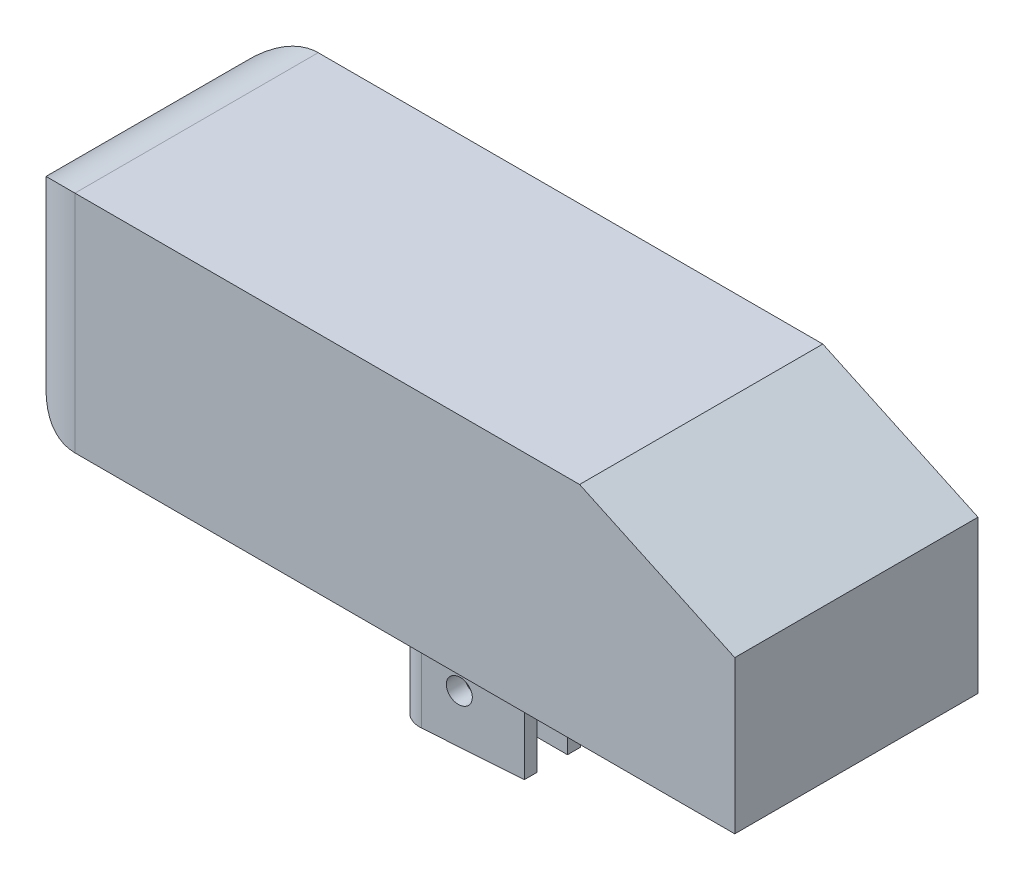
from build123d import *

# Parameters (mm, degrees)
SKETCH1_W            = 1044
SKETCH1_H            = 348
BOSS_EXTRUDE1_DEPTH  = 321.9
CHAMFER2_SIZE        = 222
CHAMFER2_SIZE2       = 103.52030011
FILLET1_R            = 100
SCALE1_SCALE         = 0.115
SKETCH175_W          = 20
SKETCH175_H          = 12
BOSS_EXTRUDE12_DEPTH = 25
SKETCH176_W          = 5
SKETCH176_H          = 25
CUT_EXTRUDE1_DEPTH   = 30
SKETCH177_R          = 2
CUT_EXTRUDE2_DEPTH   = 30
CUT_EXTRUDE4_DEPTH   = 25
FILLET3_R            = 4


with BuildPart() as part:
    # Sketch1 → Boss-Extrude1 (new body)
    with BuildSketch(Plane(origin=(0, 0, 0), x_dir=(1, 0, 0), z_dir=(0, 1, 0))):
        Rectangle(SKETCH1_W, SKETCH1_H)
    extrude(amount=BOSS_EXTRUDE1_DEPTH)

    # Chamfer2
    chamfer2_edges = [part.edges().sort_by_distance(p)[0] for p in [
        (522, 321.9, 0),
    ]]
    chamfer2_side = [part.faces().sort_by_distance(p)[0] for p in [
        (0, 321.9, 0),
    ]]
    chamfer(chamfer2_edges, length=CHAMFER2_SIZE, length2=CHAMFER2_SIZE2, reference=chamfer2_side[0])

    # Fillet1
    fillet1_edges = [part.edges().sort_by_distance(p)[0] for p in [
        (-522, 321.9, 0),
        (-522, 0, 0),
        (-522, 160.95, -174),
        (-522, 160.95, 174),
    ]]
    fillet(fillet1_edges, radius=FILLET1_R)


with BuildPart() as part_1:
    # Scale1: scaled about (-4.978902211, 156.372589253, 0)
    add(part.part.scale(SCALE1_SCALE).moved(Location((-4.406328457, 138.389741489, 0))))


with BuildPart() as boss_extrude12_tool:
    # Sketch175 → Boss-Extrude12 (new body)
    with BuildSketch(Plane.XZ.offset(-138.389734505)):
        with Locations((-4.405349795, 0)):
            Rectangle(SKETCH175_W, SKETCH175_H)
    extrude(amount=BOSS_EXTRUDE12_DEPTH)


with BuildPart() as part_2:
    add(part_1.part)


with BuildPart() as part_3:
    # Boss-Extrude12: joined with boss_extrude12_tool
    add(part_2.part.fuse(boss_extrude12_tool.part, tol=0.00001))

    # Sketch176 → Cut-Extrude1 (cut)
    with BuildSketch(Plane(origin=(5.594650205, 0, 0), x_dir=(0, 0, -1), z_dir=(1, 0, 0))):
        with Locations((0, 125.889734505)):
            Rectangle(SKETCH176_W, SKETCH176_H)
    extrude(amount=-CUT_EXTRUDE1_DEPTH, mode=Mode.SUBTRACT)

    # Sketch177 → Cut-Extrude2 (cut)
    with BuildSketch(Plane(origin=(0, 0, -6), x_dir=(-1, 0, 0), z_dir=(0, 0, -1))):
        with Locations((4.405349795, 121.389734505)):
            Circle(SKETCH177_R)
    extrude(amount=-CUT_EXTRUDE2_DEPTH, mode=Mode.SUBTRACT)

    # Sketch179 → Cut-Extrude4 (cut)
    with BuildSketch(Plane.XZ.offset(-113.389734505)):
        Polygon((-14.405349795, 6), (20.594650205, 3.552561582), (20.594650205, -3.552561582), (-14.405349795, -6), (23.594650205, -6), (23.594650205, 6), align=None)
    extrude(amount=-CUT_EXTRUDE4_DEPTH, mode=Mode.SUBTRACT)

    # Fillet3
    # the kernel refuses this fillet: 4 mm, written as the material it takes off along each edge
    with BuildSketch(Plane(origin=(-14.405349795, 138.389734505, -6), x_dir=(0, 0, 1), z_dir=(0, -1, 0))) as fillet3_piece_1:
        with BuildLine():
            CenterArc((4.284048925, -3.922405803), FILLET3_R, 101.30386139, 82.69613861)
            Line((0.293792724, -4.201431698), (0.2139876, -4.207012216))
            Line((0.2139876, -4.207012216), (-0.079805124, -0.005580518))
            Line((-0.079805124, -0.005580518), (0, 0.08))
            ThreePointArc((0, 0.08), (1.75, 0.08), (3.484319021, 0.078448116))
            Line((3.484319021, 0.078448116), (3.5, 0))
        make_face()
    extrude(amount=35.529227915, mode=Mode.SUBTRACT)
    with BuildSketch(Plane(origin=(-14.405349795, 138.389734505, 6), x_dir=(0, 0, -1), z_dir=(0, -1, 0))) as fillet3_piece_2:
        with BuildLine():
            CenterArc((4.284048925, 3.922405803), FILLET3_R, 176, 82.69613861)
            Line((0.293792724, 4.201431698), (0.2139876, 4.207012216))
            Line((0.2139876, 4.207012216), (-0.079805124, 0.005580518))
            Line((-0.079805124, 0.005580518), (0, -0.08))
            ThreePointArc((0, -0.08), (1.75, -0.08), (3.484319021, -0.078448116))
            Line((3.484319021, -0.078448116), (3.5, 0))
        make_face()
    extrude(amount=35.529227915, mode=Mode.SUBTRACT)


solid = part_3.part
